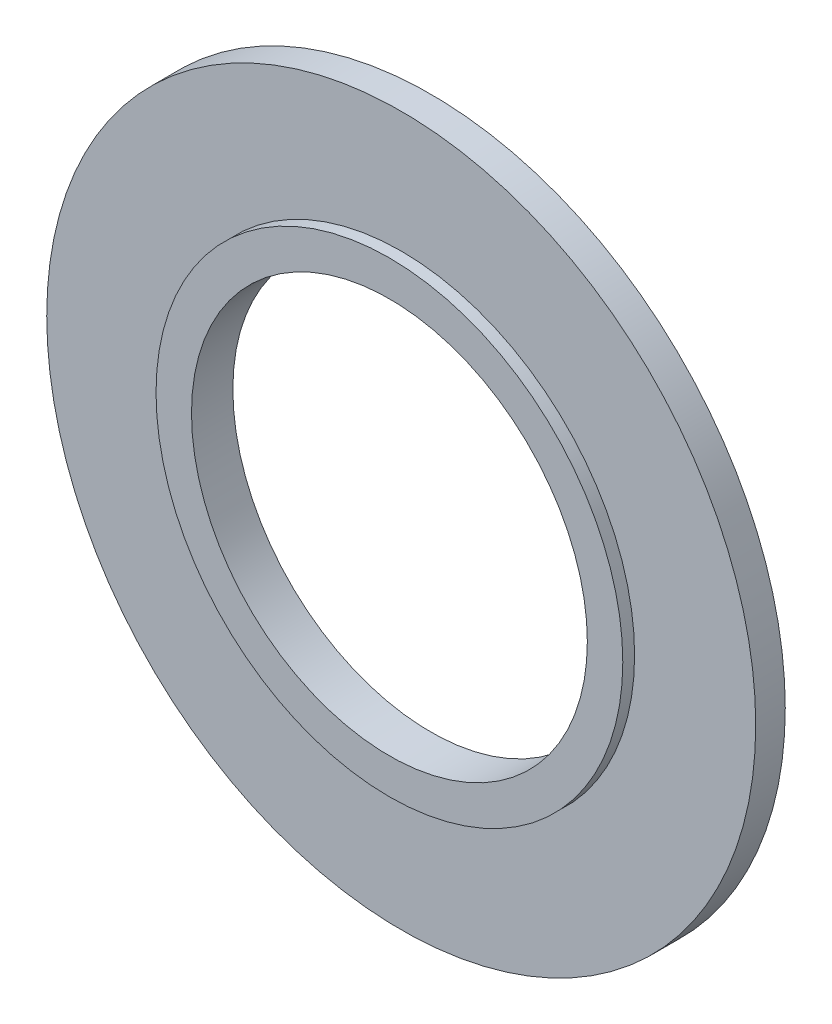
from build123d import *

# Parameters (mm, degrees)
SKETCH1_R           = 30
SKETCH1_R_2         = 16.75
BOSS_EXTRUDE1_DEPTH = 3.5
CUT_EXTRUDE1_START  = -1
SKETCH2_R           = 30
SKETCH2_R_2         = 19.75
CUT_EXTRUDE1_DEPTH  = 1


with BuildPart() as part:
    # Sketch1 → Boss-Extrude1 (new body)
    with BuildSketch(Plane.XY):
        Circle(SKETCH1_R)
        Circle(SKETCH1_R_2, mode=Mode.SUBTRACT)
    extrude(amount=BOSS_EXTRUDE1_DEPTH)

    # Sketch2 → Cut-Extrude1 (cut)
    with BuildSketch(Plane.XY.offset(3.5).offset(CUT_EXTRUDE1_START)):
        Circle(SKETCH2_R)
        Circle(SKETCH2_R_2, mode=Mode.SUBTRACT)
    extrude(amount=CUT_EXTRUDE1_DEPTH, mode=Mode.SUBTRACT)


solid = part.part
